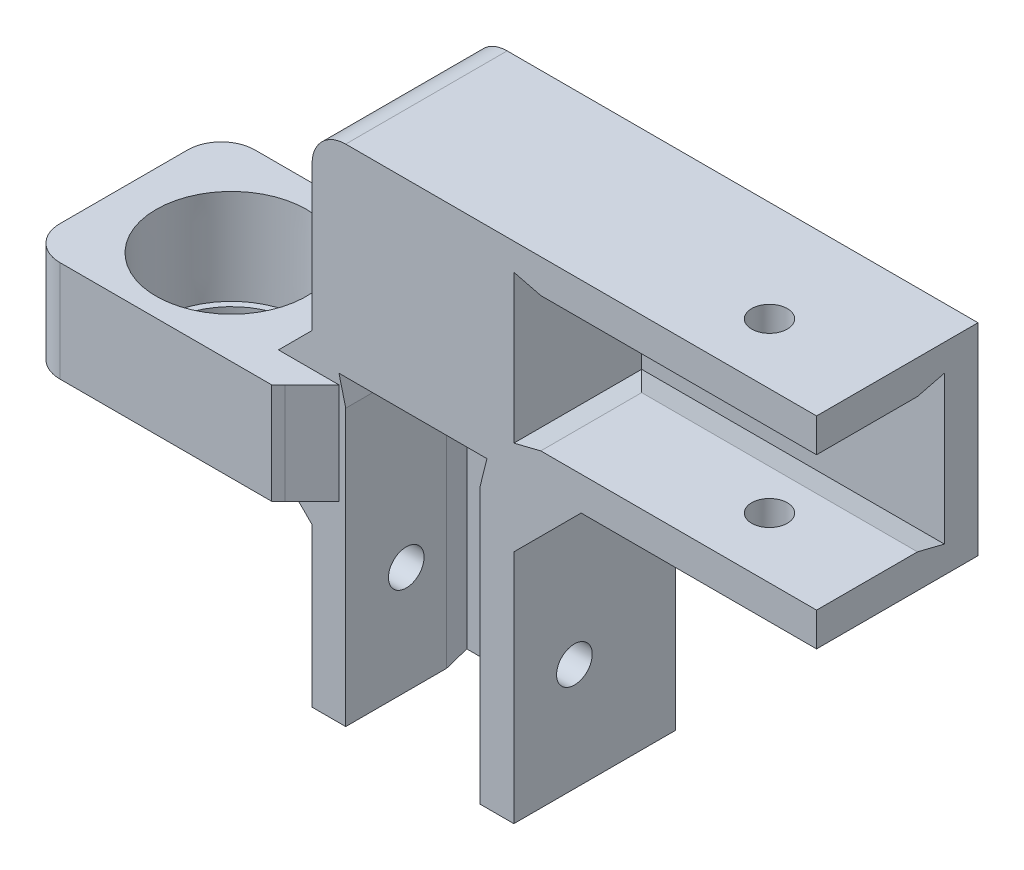
from build123d import *

# Parameters (mm, degrees)
SKETCH1_W               = 75
SKETCH1_H               = 75
BOSS_EXTRUDE1_DEPTH     = 24
SKETCH2_W               = 20
SKETCH2_H               = 19
CUT_EXTRUDE1_DEPTH      = 45
SKETCH3_W               = 19
SKETCH3_H               = 20
CUT_EXTRUDE2_DEPTH      = 45
CUT_EXTRUDE3_DEPTH      = 109.747413762
CUT_EXTRUDE3_DEPTH_BACK = 109.747413762
SKETCH4_W               = 45
SKETCH4_H               = 45
FILLET1_R               = 5
CHAMFER1_SIZE           = 10
SKETCH5_W               = 29
SKETCH5_H               = 15
BOSS_EXTRUDE2_DEPTH     = 37.5
SKETCH6_R               = 11.2
CUT_EXTRUDE4_DEPTH      = 14
FILLET2_R               = 5
CHAMFER3_SIZE           = 5
CUT_EXTRUDE5_DEPTH      = 93.146622293
CUT_EXTRUDE5_DEPTH_BACK = 93.146622293
SKETCH7_R               = 2.65
CUT_EXTRUDE6_DEPTH      = 105.986903945
CUT_EXTRUDE6_DEPTH_BACK = 105.986903945
SKETCH8_R               = 2.65
SKETCH9_R               = 2.65
CUT_EXTRUDE7_DEPTH      = 10
SKETCH10_R              = 2.65
CUT_EXTRUDE8_DEPTH      = 10
CUT_EXTRUDE12_DEPTH     = 19
CUT_EXTRUDE13_REACH     = 111.959
CUT_EXTRUDE14_REACH     = 140.283
SKETCH14_R              = 10
CUT_EXTRUDE15_DEPTH     = 10
CHAMFER5_SIZE           = 4
CHAMFER6_SIZE           = 1
CHAMFER8_SIZE           = 15
CHAMFER8_SIZE_2         = 0.23563883


# Some blends are built 0.0001 mm under size
with BuildPart() as part:
    # Sketch1 → Boss-Extrude1 (new body)
    with BuildSketch(Plane.XY):
        with Locations((37.5, 37.5)):
            Rectangle(SKETCH1_W, SKETCH1_H)
    extrude(amount=BOSS_EXTRUDE1_DEPTH)

    # Sketch2 → Cut-Extrude1 (cut)
    with BuildSketch(Plane.XZ):
        with Locations((15, 14.5)):
            Rectangle(SKETCH2_W, SKETCH2_H)
    extrude(amount=-CUT_EXTRUDE1_DEPTH, mode=Mode.SUBTRACT)

    # Sketch3 → Cut-Extrude2 (cut)
    with BuildSketch(Plane(origin=(75, 0, 0), x_dir=(0, 0, -1), z_dir=(1, 0, 0))):
        with Locations((-14.5, 60)):
            Rectangle(SKETCH3_W, SKETCH3_H)
    extrude(amount=-CUT_EXTRUDE2_DEPTH, mode=Mode.SUBTRACT)

    # Sketch4 → Cut-Extrude3 (cut, two sides: drawn at the far end of the back side and taken through both)
    with BuildSketch(Plane.XY.offset(24).offset(-CUT_EXTRUDE3_DEPTH_BACK)):
        with Locations((52.5, 22.5)):
            Rectangle(SKETCH4_W, SKETCH4_H)
    extrude(amount=CUT_EXTRUDE3_DEPTH + CUT_EXTRUDE3_DEPTH_BACK, mode=Mode.SUBTRACT)

    # Fillet1
    fillet1_edges = [part.edges().sort_by_distance(p)[0] for p in [
        (0, 75, 12),
    ]]
    fillet(fillet1_edges, radius=FILLET1_R)

    # Chamfer1
    chamfer1_edges = [part.edges().sort_by_distance(p)[0] for p in [
        (30, 45, 12),
    ]]
    chamfer(chamfer1_edges, length=CHAMFER1_SIZE)

    # Sketch5 → Boss-Extrude2 (add)
    with BuildSketch(Plane.ZY):
        with Locations((14.5, 36)):
            Rectangle(SKETCH5_W, SKETCH5_H)
    extrude(amount=BOSS_EXTRUDE2_DEPTH)

    # Sketch6 → Cut-Extrude4 (cut)
    with BuildSketch(Plane(origin=(0, 43.5, 0), x_dir=(1, 0, 0), z_dir=(0, 1, 0))):
        with Locations(Location((-21, -15.000000001, 0), (0, 0, 180))):
            Circle(SKETCH6_R)
    extrude(amount=-CUT_EXTRUDE4_DEPTH, mode=Mode.SUBTRACT)

    # Fillet2
    fillet2_edges = [part.edges().sort_by_distance(p)[0] for p in [
        (-37.5, 36, 29),
        (-37.5, 36, 0),
    ]]
    fillet(fillet2_edges, radius=FILLET2_R)

    # Chamfer3
    chamfer3_edges = [part.edges().sort_by_distance(p)[0] for p in [
        (0, 43.5, 12),
        (0, 28.5, 12),
    ]]
    chamfer(chamfer3_edges, length=CHAMFER3_SIZE)

    # Sketch7 → Cut-Extrude5 (cut, two sides: drawn at the far end of the back side and taken through both)
    with BuildSketch(Plane.XZ.offset(-45).offset(-CUT_EXTRUDE5_DEPTH_BACK)):
        with Locations((59, 15)):
            Circle(SKETCH7_R)
    extrude(amount=CUT_EXTRUDE5_DEPTH + CUT_EXTRUDE5_DEPTH_BACK, mode=Mode.SUBTRACT)

    # Sketch8 → Cut-Extrude6 (cut, two sides: drawn at the far end of the back side and taken through both)
    with BuildSketch(Plane(origin=(30, 0, 0), x_dir=(0, 0, -1), z_dir=(1, 0, 0)).offset(-CUT_EXTRUDE6_DEPTH_BACK)):
        with Locations((-15, 16)):
            Circle(SKETCH8_R)
    extrude(amount=CUT_EXTRUDE6_DEPTH + CUT_EXTRUDE6_DEPTH_BACK, mode=Mode.SUBTRACT)

    # Sketch9 → Cut-Extrude7 (cut)
    with BuildSketch(Plane.XY.offset(5)):
        with Locations((15, 22.5)):
            Circle(SKETCH9_R)
    extrude(amount=-CUT_EXTRUDE7_DEPTH, mode=Mode.SUBTRACT)

    # Sketch10 → Cut-Extrude8 (cut)
    with BuildSketch(Plane.XY.offset(5)):
        with Locations((52.5, 60)):
            Circle(SKETCH10_R)
    extrude(amount=-CUT_EXTRUDE8_DEPTH, mode=Mode.SUBTRACT)

    # Sketch11 → Cut-Extrude12 (cut)
    with BuildSketch(Plane.XY.offset(24)):
        Polygon((34, 70), (30, 71), (30, 70), align=None)
        Polygon((30, 50), (34, 50), (30, 49), align=None)
        Polygon((26, 45), (25, 41), (25, 45), align=None)
        Polygon((5, 45), (4, 45), (5, 41), align=None)
    extrude(amount=-CUT_EXTRUDE12_DEPTH, mode=Mode.SUBTRACT)

    # Cut-Extrude13: up to this face of the body (flat: up to its plane)
    cut_extrude13_end = Plane(part.part.faces().sort_by_distance((15, 45, 14.5))[0])
    # Sketch12 → Cut-Extrude13 (cut, up to the picked face)
    with BuildSketch(Plane.XZ, mode=Mode.PRIVATE) as cut_extrude13_sk1:
        Polygon((5, 5), (4, 5), (5, 9), align=None)
    cut_extrude13_tool1 = split(extrude(cut_extrude13_sk1.sketch, amount=-CUT_EXTRUDE13_REACH, mode=Mode.PRIVATE), bisect_by=cut_extrude13_end, keep=Keep.BOTH, mode=Mode.PRIVATE)
    # Sketch12 → Cut-Extrude13 (cut, up to the picked face)
    with BuildSketch(Plane.XZ, mode=Mode.PRIVATE) as cut_extrude13_sk2:
        Polygon((25, 5), (26, 5), (25, 9), align=None)
    cut_extrude13_tool2 = split(extrude(cut_extrude13_sk2.sketch, amount=-CUT_EXTRUDE13_REACH, mode=Mode.PRIVATE), bisect_by=cut_extrude13_end, keep=Keep.BOTH, mode=Mode.PRIVATE)
    add(cut_extrude13_tool1.solids().sort_by(Axis((4.666667, 0, 6.333333), (0, 1, 0)))[0], mode=Mode.SUBTRACT)
    add(cut_extrude13_tool2.solids().sort_by(Axis((25.333333, 0, 6.333333), (0, 1, 0)))[0], mode=Mode.SUBTRACT)

    # Cut-Extrude14: up to this face of the body (flat: up to its plane)
    cut_extrude14_end = Plane(part.part.faces().sort_by_distance((30, 60, 14.5))[0])
    # Sketch13 → Cut-Extrude14 (cut, up to the picked face)
    with BuildSketch(Plane(origin=(75, 0, 0), x_dir=(0, 0, -1), z_dir=(1, 0, 0)), mode=Mode.PRIVATE) as cut_extrude14_sk1:
        Polygon((-5, 50), (-5, 49), (-9, 50), align=None)
    cut_extrude14_tool1 = split(extrude(cut_extrude14_sk1.sketch, amount=-CUT_EXTRUDE14_REACH, mode=Mode.PRIVATE), bisect_by=cut_extrude14_end, keep=Keep.BOTH, mode=Mode.PRIVATE)
    # Sketch13 → Cut-Extrude14 (cut, up to the picked face)
    with BuildSketch(Plane(origin=(75, 0, 0), x_dir=(0, 0, -1), z_dir=(1, 0, 0)), mode=Mode.PRIVATE) as cut_extrude14_sk2:
        Polygon((-5, 70), (-5, 71), (-9, 70), align=None)
    cut_extrude14_tool2 = split(extrude(cut_extrude14_sk2.sketch, amount=-CUT_EXTRUDE14_REACH, mode=Mode.PRIVATE), bisect_by=cut_extrude14_end, keep=Keep.BOTH, mode=Mode.PRIVATE)
    add(cut_extrude14_tool1.solids().sort_by(Axis((75, 49.666667, 6.333333), (-1, 0, 0)))[0], mode=Mode.SUBTRACT)
    add(cut_extrude14_tool2.solids().sort_by(Axis((75, 70.333333, 6.333333), (-1, 0, 0)))[0], mode=Mode.SUBTRACT)

    # Sketch14 → Cut-Extrude15 (cut)
    with BuildSketch(Plane(origin=(0, 29.5, 0), x_dir=(1, 0, 0), z_dir=(0, 1, 0))):
        with Locations(Location((-21, -15.000000001, 0), (0, 0, 180))):
            Circle(SKETCH14_R)
    extrude(amount=-CUT_EXTRUDE15_DEPTH, mode=Mode.SUBTRACT)

    # Chamfer5
    chamfer5_edges = [part.edges().sort_by_distance(p)[0] for p in [
        (0, 36, 24),
    ]]
    chamfer(chamfer5_edges, length=CHAMFER5_SIZE)

    # Chamfer6
    chamfer6_edges = [part.edges().sort_by_distance(p)[0] for p in [
        (0, 36, 29),
    ]]
    chamfer(chamfer6_edges, length=CHAMFER6_SIZE - 0.0001)  # a hair under: the kernel refuses the full size

    # Chamfer8
    # the kernel refuses this chamfer: 15, 0.23563883 mm, written as the material it adds along each edge
    with BuildSketch(Plane(origin=(-21, 29.5, 15.000000001), x_dir=(-1, 0, 0), z_dir=(0, 0, -1))) as chamfer8_piece_1_section:
        Polygon((11.2, CHAMFER8_SIZE), (11.2 - CHAMFER8_SIZE_2, 0), (11.2, 0), align=None)
    chamfer8_piece_1 = revolve(axis=Axis((-21, 29.5, 15.000000001), (0, 1, 0)), mode=Mode.PRIVATE)
    chamfer8_piece_1 = split(chamfer8_piece_1, bisect_by=Plane(origin=(-9.855053723, 43.5, 15.000000001), z_dir=(0, -1, 0)), keep=Keep.TOP, mode=Mode.PRIVATE)
    add(chamfer8_piece_1)


solid = part.part
